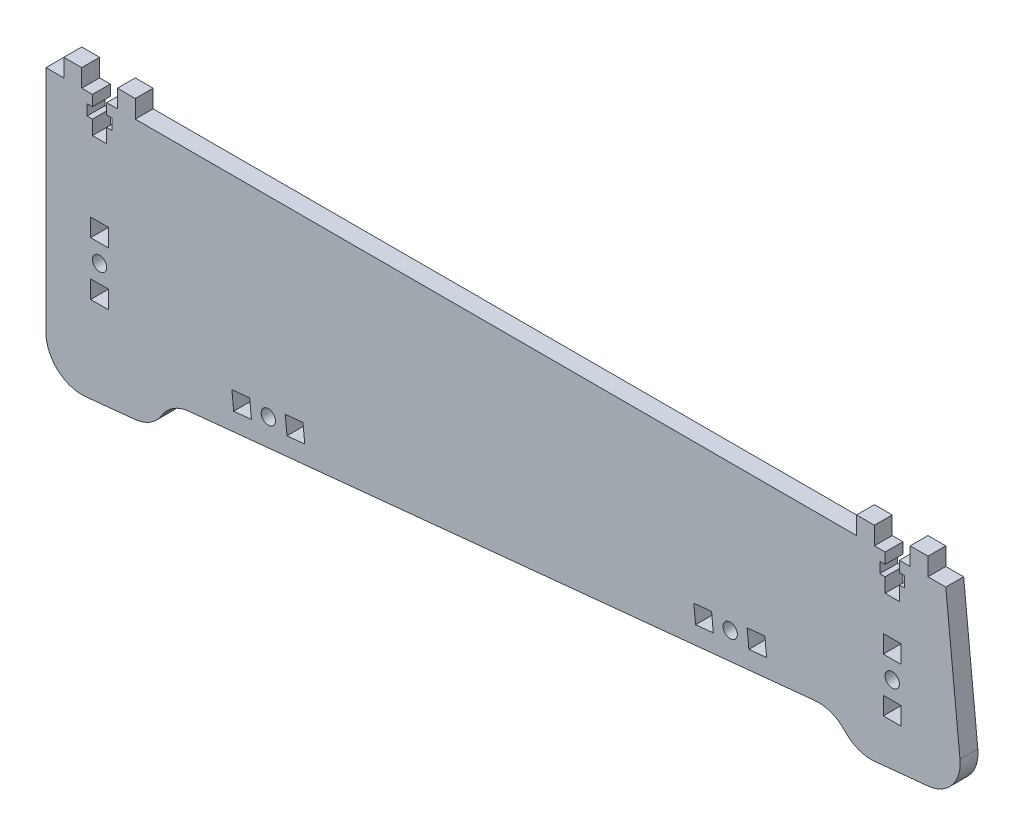
from build123d import *

# Parameters (mm, degrees)
ESQUISSE1_W        = 5
ESQUISSE1_H        = 5
ESQUISSE1_R        = 2
BOSS_EXTRU_1_DEPTH = 5
CONG_1_R           = 10


with BuildPart() as part:
    # Esquisse1 → Boss.-Extru.1 (new body)
    with BuildSketch(Plane.XY):
        Polygon((15, 0), (10, 0), (10, 5), (5, 5), (5, 0), (2, 0), (2, -3), (3.5, -3), (3.5, -6), (2, -6), (2, -10), (-2, -10), (-2, -6), (-3.5, -6), (-3.5, -3), (-2, -3), (-2, 0), (-5, 0), (-5, 5), (-10, 5), (-10, 0), (-15, 0), (-15, -75.371818049), (14.852006469, -72.395627572), (20.02875697, -63.839854419), (205.344258903, -45.364237629), (212.108310991, -52.729534592), (241.96031746, -49.753344116), (237, 0), (232, 0), (232, 5), (227, 5), (227, 0), (224, 0), (224, -3), (225.5, -3), (225.5, -6), (224, -6), (224, -10), (220, -10), (220, -6), (218.5, -6), (218.5, -3), (220, -3), (220, 0), (217, 0), (217, 5), (212, 5), (212, 0), (207, 0), align=None)
        with Locations((0, -47.5)):
            Rectangle(ESQUISSE1_W, ESQUISSE1_H, mode=Mode.SUBTRACT)
        Polygon((42.039762682, -51.595821645), (42.535794429, -56.571156057), (37.560460017, -57.067187803), (37.064428271, -52.091853391), align=None, mode=Mode.SUBTRACT)
        with Locations((47.263112967, -53.587457105)):
            Circle(ESQUISSE1_R, mode=Mode.SUBTRACT)
        with Locations((0, -40)):
            Circle(ESQUISSE1_R, mode=Mode.SUBTRACT)
        Polygon((57.461797663, -55.083060818), (52.486463252, -55.579092564), (51.990431506, -50.603758153), (56.965765917, -50.107726407), align=None, mode=Mode.SUBTRACT)
        Polygon((171.398457383, -38.698996248), (171.894489129, -43.67433066), (166.919154718, -44.170362406), (166.423122972, -39.195027994), align=None, mode=Mode.SUBTRACT)
        with Locations((176.621807668, -40.690631708)):
            Circle(ESQUISSE1_R, mode=Mode.SUBTRACT)
        Polygon((186.820492364, -42.186235422), (181.845157952, -42.682267168), (181.349126206, -37.706932756), (186.324460618, -37.21090101), align=None, mode=Mode.SUBTRACT)
        with Locations((222, -37.5)):
            Rectangle(ESQUISSE1_W, ESQUISSE1_H, mode=Mode.SUBTRACT)
        with Locations((0, -32.5)):
            Rectangle(ESQUISSE1_W, ESQUISSE1_H, mode=Mode.SUBTRACT)
        with Locations((222, -30)):
            Circle(ESQUISSE1_R, mode=Mode.SUBTRACT)
        with Locations((222, -22.5)):
            Rectangle(ESQUISSE1_W, ESQUISSE1_H, mode=Mode.SUBTRACT)
    extrude(amount=BOSS_EXTRU_1_DEPTH)

    # Congé1
    cong_1_edges = [part.edges().sort_by_distance(p)[0] for p in [
        (241.96031746, -49.753344116, 2.5),
        (205.344258903, -45.364237629, 2.5),
        (212.108310991, -52.729534592, 2.5),
        (-15, -75.371818049, 2.5),
        (20.02875697, -63.839854419, 2.5),
        (14.852006469, -72.395627572, 2.5),
    ]]
    fillet(cong_1_edges, radius=CONG_1_R - 0.0001)  # a hair under: the kernel refuses the full size


solid = part.part
